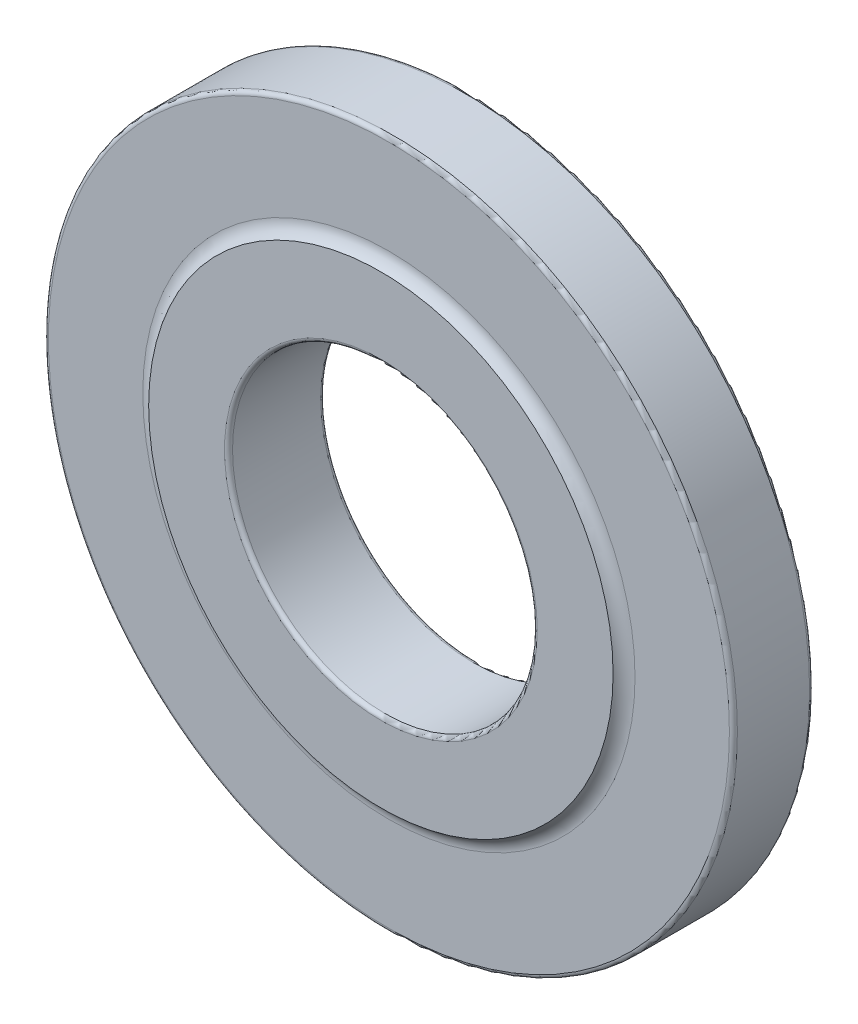
from build123d import *

# Parameters (mm, degrees)
BOSS_EXTRU_1_DEPTH      = 3
BOSS_EXTRU_1_DEPTH_BACK = 3
ESQUISSE1_R             = 14.477835748
ESQUISSE1_R_2           = 9.5
BOSS_EXTRU_2_DEPTH      = 2.5
BOSS_EXTRU_2_DEPTH_BACK = 2.5
ESQUISSE3_R             = 21.478063627
ESQUISSE3_R_2           = 14.477835748
CONG_1_R                = 0.25
CONG_2_R                = 1
CONG_3_R                = 0.25


with BuildPart() as part:
    # Esquisse1 → Boss.-Extru.1 (new, two sides: drawn at the far end of the back side and taken through both)
    with BuildSketch(Plane.XY.offset(-BOSS_EXTRU_1_DEPTH_BACK)):
        Circle(ESQUISSE1_R)
        Circle(ESQUISSE1_R_2, mode=Mode.SUBTRACT)
    extrude(amount=BOSS_EXTRU_1_DEPTH + BOSS_EXTRU_1_DEPTH_BACK)

    # Esquisse3 → Boss.-Extru.2 (add, two sides: drawn at the far end of the back side and taken through both)
    with BuildSketch(Plane.XY.offset(-BOSS_EXTRU_2_DEPTH_BACK)):
        Circle(ESQUISSE3_R)
        Circle(ESQUISSE3_R_2, mode=Mode.SUBTRACT)
    extrude(amount=BOSS_EXTRU_2_DEPTH + BOSS_EXTRU_2_DEPTH_BACK)

    # Congé1
    cong_1_edges = [part.edges().sort_by_distance(p)[0] for p in [
        (-21.478063627, 0, -2.5),
        (-21.478063627, 0, 2.5),
    ]]
    fillet(cong_1_edges, radius=CONG_1_R)

    # Congé2
    # the kernel refuses this fillet: 1 mm, written as the material it adds along each edge
    with BuildSketch(Plane(origin=(0, 0, 2.5), x_dir=(1, 0, 0), z_dir=(0, -1, 0))) as cong_2_piece_1:
        with BuildLine():
            CenterArc((15.343861152, 1), CONG_2_R, 210, 60)
            Line((14.477835748, 0.5), (14.46051524, 0.49))
            ThreePointArc((14.46051524, 0.49), (14.457835748, 0.25), (14.457835748, 0))
            Line((14.457835748, 0), (14.477835748, -0.02))
            Line((14.477835748, -0.02), (15.343861152, -0.02))
            Line((15.343861152, -0.02), (15.343861152, 0))
        make_face()
    revolve(axis=Axis((0, 0, 2.5), (0, 0, 1)))
    with BuildSketch(Plane(origin=(0, 0, -2.5), x_dir=(1, 0, 0), z_dir=(0, -1, 0))) as cong_2_piece_2:
        with BuildLine():
            CenterArc((15.343861152, -1), CONG_2_R, 90, 60)
            Line((14.477835748, -0.5), (14.46051524, -0.49))
            ThreePointArc((14.46051524, -0.49), (14.457835748, -0.25), (14.457835748, 0))
            Line((14.457835748, 0), (14.477835748, 0.02))
            Line((14.477835748, 0.02), (15.343861152, 0.02))
            Line((15.343861152, 0.02), (15.343861152, 0))
        make_face()
    revolve(axis=Axis((0, 0, -2.5), (0, 0, 1)))

    # Congé3
    cong_3_edges = [part.edges().sort_by_distance(p)[0] for p in [
        (-9.5, 0, -3),
        (-9.5, 0, 3),
    ]]
    fillet(cong_3_edges, radius=CONG_3_R)


solid = part.part
